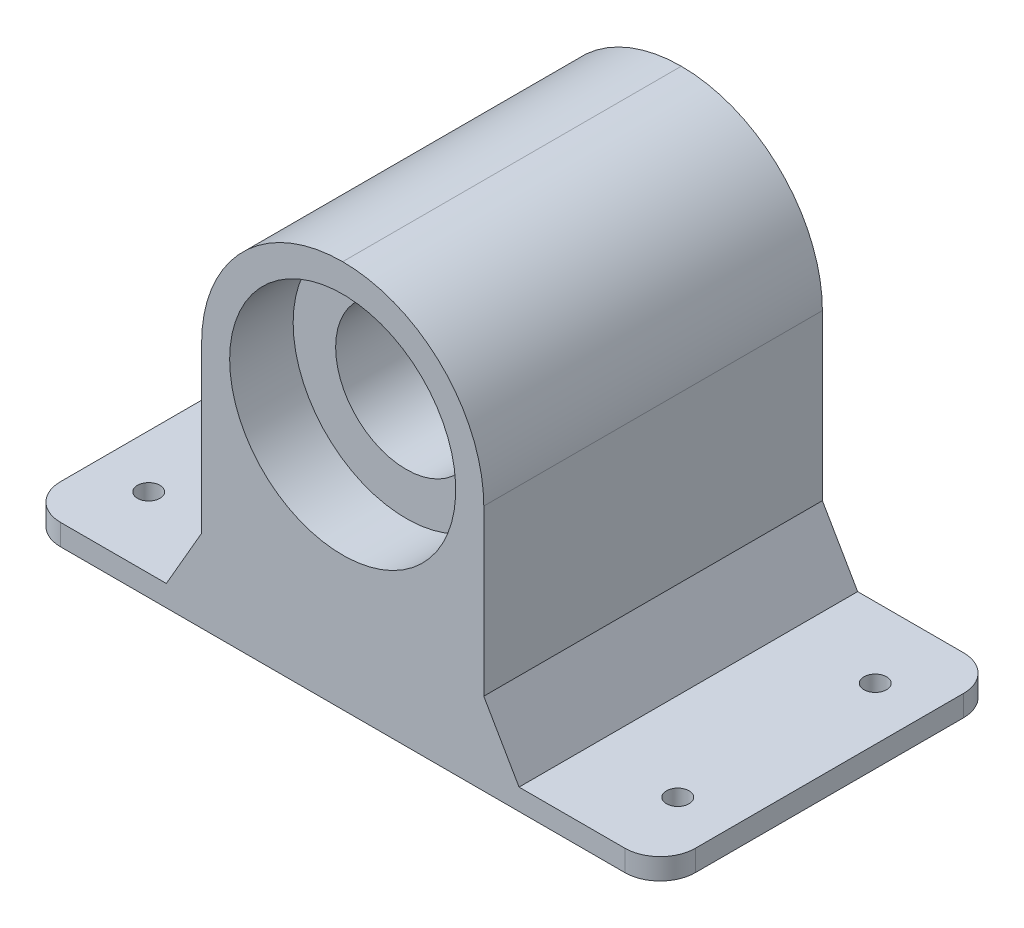
from build123d import *
from OCP.BRepFilletAPI import BRepFilletAPI_MakeChamfer

# Parameters (mm, degrees)
SKETCH_1_R          = 10
EXTRUDE_1_DEPTH     = 24
SKETCH_4_R          = 16.025
CUT_EXTRUDE_3_DEPTH = 9
SKETCH_5_W          = 48
SKETCH_5_H          = 3
EXTRUDE_2_DEPTH     = 25
CHAMFER_1_SIZE      = 5
CHAMFER_1_SIZE2     = 8.660254038
SKETCH_7_R          = 1.6
CUT_EXTRUDE_4_DEPTH = 76.00666637
FILLET_1_R          = 20
FILLET_2_R          = 5


with BuildPart() as part:
    # 草图1 → 凸台-拉伸1 (new, symmetric)
    with BuildSketch(Plane.XY):
        Polygon((-20, -35), (-20, 0), (-20, 20), (20, 20), (20, 0), (20, -35), align=None)
        Circle(SKETCH_1_R, mode=Mode.SUBTRACT)
    extrude(amount=EXTRUDE_1_DEPTH, both=True)

    # 草图4 → 切除-拉伸3 (cut)
    with BuildSketch(Plane(origin=(0, 0, -24), x_dir=(-1, 0, 0), z_dir=(0, 0, -1))):
        Circle(SKETCH_4_R)
    cut_extrude_3 = extrude(amount=-CUT_EXTRUDE_3_DEPTH, mode=Mode.SUBTRACT)

    # 镜向1: 切除-拉伸3 across plane
    add(cut_extrude_3.mirror(Plane.XY), mode=Mode.SUBTRACT)

    # 草图5 → 凸台-拉伸2 (add)
    with BuildSketch(Plane(origin=(20, 0, 0), x_dir=(0, 0, -1), z_dir=(1, 0, 0))):
        with Locations((0, -33.5)):
            Rectangle(SKETCH_5_W, SKETCH_5_H)
    extrude_2 = extrude(amount=EXTRUDE_2_DEPTH)

    # 镜向2: 凸台-拉伸2 across plane
    add(extrude_2.mirror(Plane.ZY))

    # 倒角1: one chamfer whose edges measure the first distance from different faces: ONE call of the kernel's chamfer builder (chamfer() names one face for all edges)
    chamfer_1_edges_1 = [part.edges().sort_by_distance(p)[0] for p in [
        (20, -32, 0),
    ]]
    chamfer_1_side_1 = [part.faces().sort_by_distance(p)[0] for p in [
        (32.5, -32, 0),
    ]]
    chamfer_1_edges_2 = [part.edges().sort_by_distance(p)[0] for p in [
        (-20, -32, 0),
    ]]
    chamfer_1_side_2 = [part.faces().sort_by_distance(p)[0] for p in [
        (-32.5, -32, 0),
    ]]
    chamfer_1 = BRepFilletAPI_MakeChamfer(part.part.solid().wrapped)
    for e in chamfer_1_edges_1:
        chamfer_1.Add(CHAMFER_1_SIZE, CHAMFER_1_SIZE2, e.wrapped, chamfer_1_side_1[0].wrapped)  # the first distance lies on this face
    for e in chamfer_1_edges_2:
        chamfer_1.Add(CHAMFER_1_SIZE, CHAMFER_1_SIZE2, e.wrapped, chamfer_1_side_2[0].wrapped)  # the first distance lies on this face
    add(Compound.cast(chamfer_1.Shape()), mode=Mode.REPLACE)

    # 草图7 → 切除-拉伸4 (cut, through all)
    with BuildSketch(Plane.XZ.offset(35)):
        with Locations(Location((37.5, 14, 0), (0, 0, 270))):
            Circle(SKETCH_7_R)
        with Locations(Location((37.5, -14, 0), (0, 0, 270))):
            Circle(SKETCH_7_R)
        with Locations(Location((-37.5, 14, 0), (0, 0, 90))):
            Circle(SKETCH_7_R)
        with Locations(Location((-37.5, -14, 0), (0, 0, 90))):
            Circle(SKETCH_7_R)
    extrude(amount=-CUT_EXTRUDE_4_DEPTH, mode=Mode.SUBTRACT)

    # 圆角1
    fillet_1_edges = [part.edges().sort_by_distance(p)[0] for p in [
        (20, 20, 0),
        (-20, 20, 0),
    ]]
    fillet(fillet_1_edges, radius=FILLET_1_R - 0.0001)  # a hair under: the kernel refuses the full size

    # 圆角2
    fillet_2_edges = [part.edges().sort_by_distance(p)[0] for p in [
        (45, -33.5, 24),
        (45, -33.5, -24),
        (-45, -33.5, 24),
        (-45, -33.5, -24),
    ]]
    fillet(fillet_2_edges, radius=FILLET_2_R)


solid = part.part
